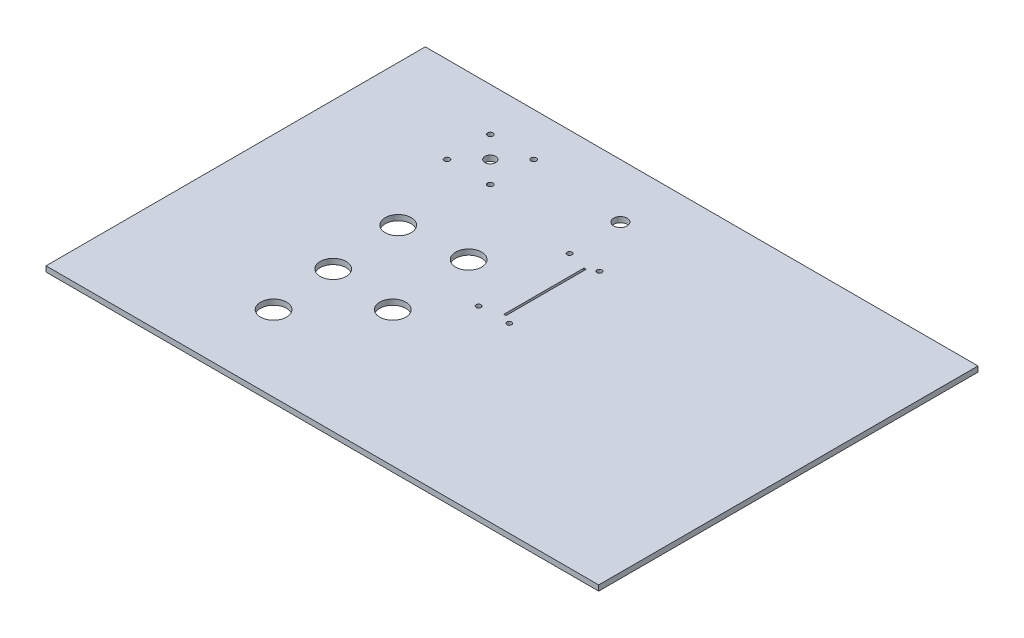
from build123d import *

# Parameters (mm, degrees)
SKETCH1_W           = 510
SKETCH1_H           = 350
BOSS_EXTRUDE1_DEPTH = 5
SKETCH2_R           = 5
SKETCH2_R_2         = 2.5
JOYYSTICK1_DEPTH    = 619.566892098
SKETCH3_R           = 12
BUTTONS1_DEPTH      = 619.566892098
SKETCH4_R           = 6.25
ROCKET_SWITCH_DEPTH = 619.566892098
SKETCH5_R           = 2.25
SKETCH5_W           = 2
SKETCH5_H           = 74
CUT_EXTRUDE4_DEPTH  = 619.566892098


with BuildPart() as part:
    # Sketch1 → Boss-Extrude1 (new body)
    with BuildSketch(Plane(origin=(0, 0, 0), x_dir=(1, 0, 0), z_dir=(0, 1, 0))):
        with Locations((255, 175)):
            Rectangle(SKETCH1_W, SKETCH1_H)
    extrude(amount=BOSS_EXTRUDE1_DEPTH)

    # Sketch2 → Joyystick1 (cut, through all)
    with BuildSketch(Plane(origin=(0, 5, 0), x_dir=(1, 0, 0), z_dir=(0, 1, 0))):
        with Locations((120, 290)):
            Circle(SKETCH2_R)
        with Locations((140, 310)):
            Circle(SKETCH2_R_2)
        with Locations((140, 270)):
            Circle(SKETCH2_R_2)
        with Locations((100, 270)):
            Circle(SKETCH2_R_2)
        with Locations((100, 310)):
            Circle(SKETCH2_R_2)
    extrude(amount=-JOYYSTICK1_DEPTH, mode=Mode.SUBTRACT)

    # Sketch3 → buttons1 (cut, through all)
    with BuildSketch(Plane(origin=(0, 5, 0), x_dir=(1, 0, 0), z_dir=(0, 1, 0))):
        with Locations((130, 195)):
            Circle(SKETCH3_R)
        with Locations((190, 200)):
            Circle(SKETCH3_R)
        with Locations((135, 130)):
            Circle(SKETCH3_R)
        with Locations((195, 125)):
            Circle(SKETCH3_R)
        with Locations((140, 70)):
            Circle(SKETCH3_R)
    extrude(amount=-BUTTONS1_DEPTH, mode=Mode.SUBTRACT)

    # Sketch4 → rocket Switch (cut, through all)
    with BuildSketch(Plane(origin=(0, 5, 0), x_dir=(1, 0, 0), z_dir=(0, 1, 0))):
        with Locations((230, 300)):
            Circle(SKETCH4_R)
    extrude(amount=-ROCKET_SWITCH_DEPTH, mode=Mode.SUBTRACT)

    # Sketch5 → Cut-Extrude4 (cut, through all)
    with BuildSketch(Plane(origin=(0, 5, 0), x_dir=(1, 0, 0), z_dir=(0, 1, 0))):
        with Locations((231.71904348, 251.400577354)):
            Circle(SKETCH5_R)
        with Locations((259.716221431, 251.0030515)):
            Circle(SKETCH5_R)
        with Locations((259.716221431, 167.798103207)):
            Circle(SKETCH5_R)
        with Locations((231.71904348, 167.400577354)):
            Circle(SKETCH5_R)
        with Locations((251, 209.400577354)):
            Rectangle(SKETCH5_W, SKETCH5_H)
    extrude(amount=-CUT_EXTRUDE4_DEPTH, mode=Mode.SUBTRACT)


solid = part.part
